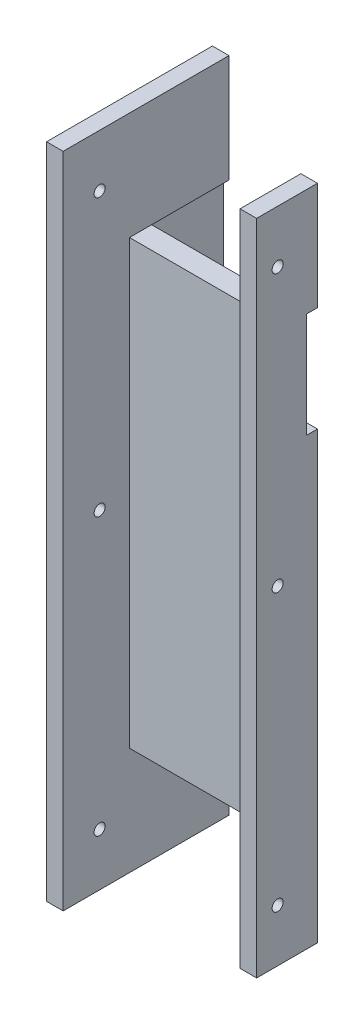
from build123d import *

# Parameters (mm, degrees)
SKETCH_1_W          = 5.5
SKETCH_1_H          = 59.5
EXTRUDE_1_DEPTH     = 1.5
SKETCH_2_W          = 3
SKETCH_2_H          = 40
EXTRUDE_2_DEPTH     = 12.5
SKETCH_3_W          = 15
SKETCH_3_H          = 59.5
EXTRUDE_3_DEPTH     = 1.5
SKETCH_4_W          = 14
SKETCH_4_H          = 9.5
CUT_EXTRUDE_1_DEPTH = 1
SKETCH_5_W          = 7
SKETCH_5_H          = 9.5
CUT_EXTRUDE_2_DEPTH = 0.5
SKETCH_6_R          = 0.5
CUT_EXTRUDE_3_DEPTH = 2.2
SKETCH_7_R          = 0.5
CUT_EXTRUDE_4_DEPTH = 4


with BuildPart() as part:
    # 草图1 → 凸台-拉伸1 (new body)
    with BuildSketch(Plane(origin=(0, 0, 0), x_dir=(0, 0, -1), z_dir=(1, 0, 0))):
        with Locations((-1.25, 0)):
            Rectangle(SKETCH_1_W, SKETCH_1_H)
    extrude(amount=EXTRUDE_1_DEPTH)

    # 草图2 → 凸台-拉伸2 (add)
    with BuildSketch(Plane.ZY):
        Rectangle(SKETCH_2_W, SKETCH_2_H)
    extrude(amount=EXTRUDE_2_DEPTH)

    # 草图3 → 凸台-拉伸3 (add)
    with BuildSketch(Plane.ZY.offset(12.5)):
        Rectangle(SKETCH_3_W, SKETCH_3_H)
    extrude(amount=EXTRUDE_3_DEPTH)

    # 草图4 → 切除-拉伸1 (cut)
    with BuildSketch(Plane(origin=(0, 0, -1.5), x_dir=(-1, 0, 0), z_dir=(0, 0, -1))):
        with Locations((5.5, 15.25)):
            Rectangle(SKETCH_4_W, SKETCH_4_H)
    extrude(amount=-CUT_EXTRUDE_1_DEPTH, mode=Mode.SUBTRACT)

    # 草图5 → 切除-拉伸2 (cut)
    with BuildSketch(Plane(origin=(-12.5, 0, 0), x_dir=(0, 0, -1), z_dir=(1, 0, 0))):
        with Locations((4, 15.25)):
            Rectangle(SKETCH_5_W, SKETCH_5_H)
    extrude(amount=-CUT_EXTRUDE_2_DEPTH, mode=Mode.SUBTRACT)

    # 草图6 → 切除-拉伸3 (cut)
    with BuildSketch(Plane(origin=(-12.5, 0, 0), x_dir=(0, 0, -1), z_dir=(1, 0, 0))):
        with Locations((-4.2, -25)):
            Circle(SKETCH_6_R)
        with Locations((3.8, -16.5)):
            Circle(SKETCH_6_R)
        with Locations((-4.2, 0)):
            Circle(SKETCH_6_R)
        with Locations((-4.2, 25)):
            Circle(SKETCH_6_R)
        with Locations((3.8, 7.5)):
            Circle(SKETCH_6_R)
    extrude(amount=-CUT_EXTRUDE_3_DEPTH, mode=Mode.SUBTRACT)

    # 草图7 → 切除-拉伸4 (cut)
    with BuildSketch(Plane(origin=(1.5, 0, 0), x_dir=(0, 0, -1), z_dir=(1, 0, 0))):
        with Locations((-2.1, -25)):
            Circle(SKETCH_7_R)
        with Locations((-2.1, 0)):
            Circle(SKETCH_7_R)
        with Locations((-2.1, 25)):
            Circle(SKETCH_7_R)
    extrude(amount=-CUT_EXTRUDE_4_DEPTH, mode=Mode.SUBTRACT)


solid = part.part
